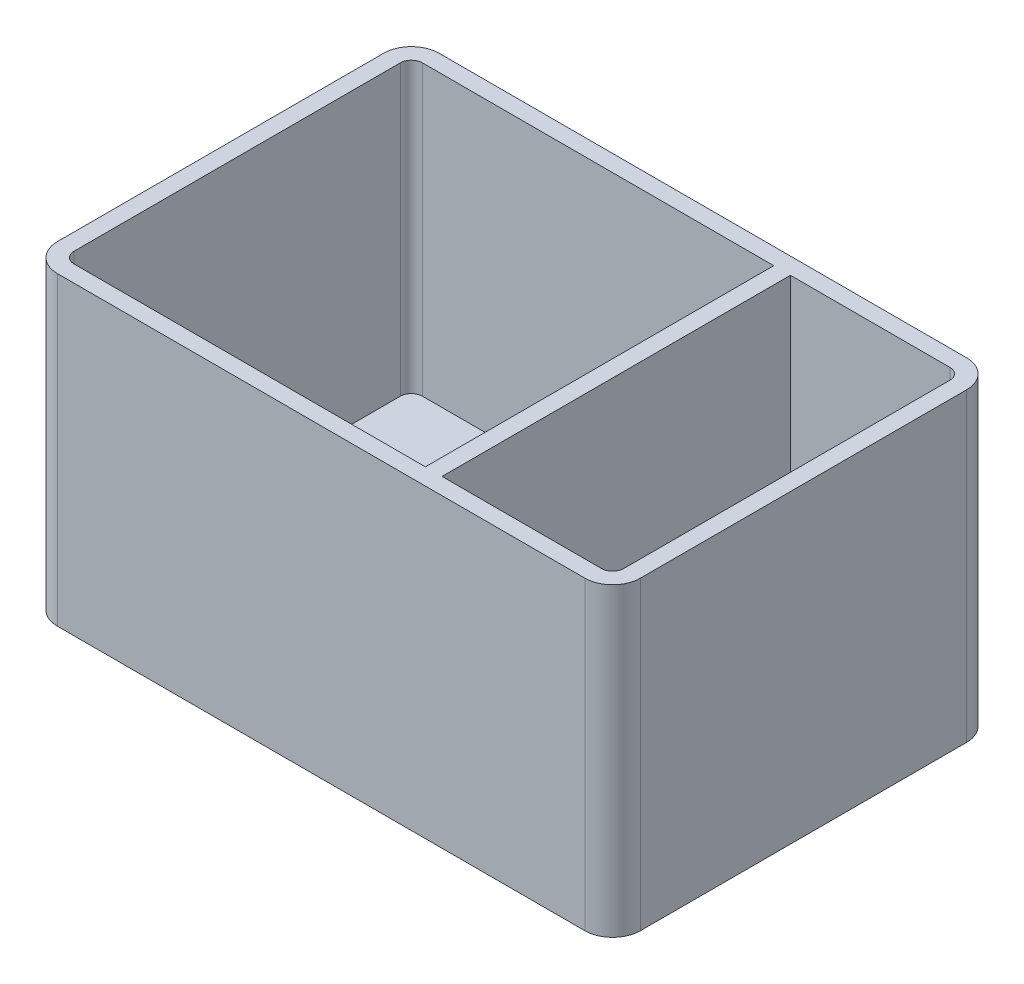
from build123d import *

# Parameters (mm, degrees)
BOSS_EXTRUDE1_DEPTH                     = 55
SHELL1_T                                = -3
CUT_EXTRUDE1_DEPTH                      = 2
BATTERY_CONNECTOR_SKETCH_3_R            = 2.15
CUT_EXTRUDE2_DEPTH                      = 3
BATTERY_CONNECTOR_SKETCH_4_R            = 2.15
CUT_EXTRUDE3_DEPTH                      = 3
BOSS_EXTRUDE6_START                     = 12.75
BOSS_EXTRUDE6_DEPTH                     = 12.75
CONNECTOR_SIDE_MOUNT_SKETCH_R           = 1.55
CONNECTOR_SIDE_MOUNT_SKETCH_R_2         = 1.505
CONNECTOR_MOUNT_PINS_SOCKETS_DEPTH      = 2.4
CONNECTOR_MOUNT_PINS_SOCKETS_SKETCH_3_W = 24.3
CONNECTOR_MOUNT_PINS_SOCKETS_SKETCH_3_H = 1.2
BOSS_EXTRUDE7_DEPTH                     = 0.7
PARTITION_SKETCH_W                      = 3
PARTITION_SKETCH_H                      = 62.75
PARTITION_BOSS_DEPTH                    = 52
SKETCH28_R                              = 3.5
PARTITION_CABLE_PASS_HOLE_DEPTH         = 3
CAVITY2_START                           = 2.577739742
CAVITY2_DEPTH                           = 0.461520646
BOSS_EXTRUDE8_DEPTH                     = 4


# Read off the part's stored shape, not the designer's step: Cavity2
with BuildPart() as part:
    # Sketch2 → Boss-Extrude1 (new body)
    with BuildSketch(Plane(origin=(0, 0, 0), x_dir=(1, 0, 0), z_dir=(0, 1, 0))):
        with BuildLine():
            Line((47.5, -34.375), (-47.5, -34.375))
            ThreePointArc((-47.5, -34.375), (-51.035533906, -32.910533906), (-52.5, -29.375))
            Line((-52.5, -29.375), (-52.5, 29.375))
            ThreePointArc((-52.5, 29.375), (-51.035533906, 32.910533906), (-47.5, 34.375))
            Line((-47.5, 34.375), (47.5, 34.375))
            ThreePointArc((47.5, 34.375), (51.035533906, 32.910533906), (52.5, 29.375))
            Line((52.5, 29.375), (52.5, -29.375))
            ThreePointArc((52.5, -29.375), (51.035533906, -32.910533906), (47.5, -34.375))
        make_face()
    extrude(amount=BOSS_EXTRUDE1_DEPTH)

    # Shell1
    shell1_openings = [part.faces().sort_by_distance(p)[0] for p in [
        (0, 55, 0),
    ]]
    offset(amount=SHELL1_T, openings=shell1_openings, kind=Kind.INTERSECTION)

    # battery_connector_sketch → Cut-Extrude1 (cut)
    with BuildSketch(Plane(origin=(0, 3, 0), x_dir=(1, 0, 0), z_dir=(0, 1, 0))):
        with BuildLine():
            Line((-48.255414742, -4.831437415), (-48.255414742, -29.131437415))
            ThreePointArc((-48.255414742, -29.131437415), (-47.669628305, -30.545650977), (-46.255414742, -31.131437415))
            Line((-46.255414742, -31.131437415), (-40.255414742, -31.131437415))
            ThreePointArc((-40.255414742, -31.131437415), (-38.84120118, -30.545650977), (-38.255414742, -29.131437415))
            Line((-38.255414742, -29.131437415), (-38.255414742, -21.901437415))
            Line((-38.255414742, -21.901437415), (-39.505414742, -20.561437415))
            Line((-39.505414742, -20.561437415), (-39.505414742, -13.401437415))
            Line((-39.505414742, -13.401437415), (-38.255414742, -12.061437415))
            Line((-38.255414742, -12.061437415), (-38.255414742, -4.831437415))
            ThreePointArc((-38.255414742, -4.831437415), (-38.84120118, -3.417223852), (-40.255414742, -2.831437415))
            Line((-40.255414742, -2.831437415), (-46.255414742, -2.831437415))
            ThreePointArc((-46.255414742, -2.831437415), (-47.669628305, -3.417223852), (-48.255414742, -4.831437415))
        make_face()
    extrude(amount=-CUT_EXTRUDE1_DEPTH, mode=Mode.SUBTRACT)

    # battery_connector_sketch<3> → Cut-Extrude2 (cut)
    with BuildSketch(Plane(origin=(0, 3, 0), x_dir=(1, 0, 0), z_dir=(0, 1, 0))):
        with Locations(Location((-43.255414742, -6.881437415, 0), (0, 0, 270))):
            Circle(BATTERY_CONNECTOR_SKETCH_3_R)
    extrude(amount=-CUT_EXTRUDE2_DEPTH, mode=Mode.SUBTRACT)

    # battery_connector_sketch<4> → Cut-Extrude3 (cut)
    with BuildSketch(Plane(origin=(0, 3, 0), x_dir=(1, 0, 0), z_dir=(0, 1, 0))):
        with Locations(Location((-43.255414742, -24.831437415, 0), (0, 0, 270))):
            Circle(BATTERY_CONNECTOR_SKETCH_4_R)
    extrude(amount=-CUT_EXTRUDE3_DEPTH, mode=Mode.SUBTRACT)

    # Sketch25 → Boss-Extrude6 (add)
    with BuildSketch(Plane(origin=(0, 3, 0), x_dir=(1, 0, 0), z_dir=(0, 1, 0)).offset(BOSS_EXTRUDE6_START)):
        with BuildLine():
            Line((-46.255414742, -31.131437415), (-48.456518483, -31.131437415))
            ThreePointArc((-48.456518483, -31.131437415), (-49.21945296, -30.396509431), (-49.5, -29.375))
            Line((-49.5, -29.375), (-49.5, -2.831437415))
            Line((-49.5, -2.831437415), (-46.255414742, -2.831437415))
            ThreePointArc((-46.255414742, -2.831437415), (-47.669628305, -3.417223852), (-48.255414742, -4.831437415))
            Line((-48.255414742, -4.831437415), (-48.255414742, -29.131437415))
            ThreePointArc((-48.255414742, -29.131437415), (-47.669628305, -30.545650977), (-46.255414742, -31.131437415))
        make_face()
    extrude(amount=-BOSS_EXTRUDE6_DEPTH)

    # connector_side_mount_sketch → connector_mount_pins_sockets (cut)
    with BuildSketch(Plane(origin=(-48.255414742, 0, 0), x_dir=(0, 0, -1), z_dir=(1, 0, 0))):
        with Locations((-9.891437415, 11.25)):
            Circle(CONNECTOR_SIDE_MOUNT_SKETCH_R)
        with Locations(Location((-24.071437415, 11.25, 0), (0, 0, 180))):
            Circle(CONNECTOR_SIDE_MOUNT_SKETCH_R_2)
    extrude(amount=-CONNECTOR_MOUNT_PINS_SOCKETS_DEPTH, mode=Mode.SUBTRACT)

    # connector_mount_pins_sockets_sketch<3> → Boss-Extrude7 (add)
    with BuildSketch(Plane(origin=(-48.255414742, 0, 0), x_dir=(0, 0, -1), z_dir=(1, 0, 0))):
        with Locations((-16.981437415, 6.6)):
            Rectangle(CONNECTOR_MOUNT_PINS_SOCKETS_SKETCH_3_W, CONNECTOR_MOUNT_PINS_SOCKETS_SKETCH_3_H)
    extrude(amount=BOSS_EXTRUDE7_DEPTH)

    # partition-sketch → partition-boss (add)
    with BuildSketch(Plane(origin=(0, 3, 0), x_dir=(1, 0, 0), z_dir=(0, 1, 0))):
        with Locations((17.270599113, 0)):
            Rectangle(PARTITION_SKETCH_W, PARTITION_SKETCH_H)
    extrude(amount=PARTITION_BOSS_DEPTH)

    # Sketch28 → partition-cable-pass-hole (cut)
    with BuildSketch(Plane(origin=(18.770599113, 0, 0), x_dir=(0, 0, -1), z_dir=(1, 0, 0))):
        with Locations((26.075, 6.6)):
            Circle(SKETCH28_R)
    extrude(amount=-PARTITION_CABLE_PASS_HOLE_DEPTH, mode=Mode.SUBTRACT)

    # Cavity2 outline → Cavity2 (cut)
    with BuildSketch(Plane(origin=(0, 0, 0), x_dir=(0.9999910167650304, -0.004238677770298889, 0), z_dir=(0.004238677770298889, 0.9999910167650305, 0)).offset(CAVITY2_START)):
        Polygon((0.430972634, 22.782282347), (9.255972634, 22.782282347), (9.255972634, 29.062282347), (-9.594027366, 29.062282347), (-9.594027366, 22.782282347), (-0.769027366, 22.782282347), (-2.890347709, 20.660962004), (-0.769027366, 18.53964166), (-9.594027366, 18.53964166), (-9.594027366, 12.25964166), (9.255972634, 12.25964166), (9.255972634, 18.53964166), (0.430972634, 18.53964166), (2.552292978, 20.660962004), align=None)
        Polygon((-0.169027366, 18.53964166), (-2.290347709, 20.660962004), (-0.169027366, 22.782282347), (1.952292978, 20.660962004), align=None, mode=Mode.SUBTRACT)
    extrude(amount=CAVITY2_DEPTH, mode=Mode.SUBTRACT)

    # Sketch32 → Boss-Extrude8 (add)
    with BuildSketch(Plane(origin=(0, 3, 0), x_dir=(1, 0, 0), z_dir=(0, 1, 0))):
        Polygon((-0.144808067, 22.60955262), (1.795970783, 20.66877377), (-0.144808067, 18.727994921), (-2.085586916, 20.66877377), align=None)
    extrude(amount=BOSS_EXTRUDE8_DEPTH)


solid = part.part
